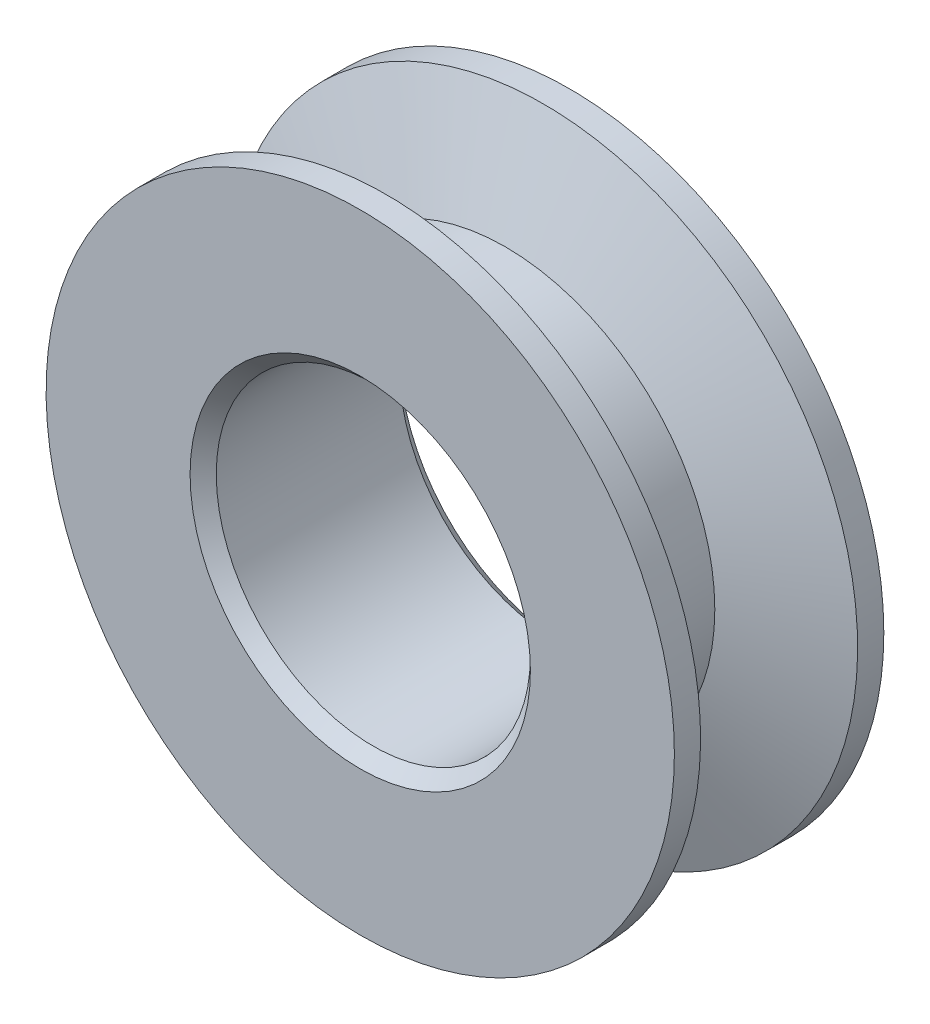
from build123d import *

# Parameters (mm, degrees)
SKETCH1_R      = 19.05
SKETCH1_R_2    = 9.525
EXTRUDE1_DEPTH = 6.35
CHAMFER1_SIZE  = 0.79375


with BuildPart() as part:
    # Sketch1 → Extrude1 (new, symmetric)
    with BuildSketch(Plane.XY):
        Circle(SKETCH1_R)
        Circle(SKETCH1_R_2, mode=Mode.SUBTRACT)
    extrude(amount=EXTRUDE1_DEPTH, both=True)

    # Chamfer1
    chamfer1_edges = [part.edges().sort_by_distance(p)[0] for p in [
        (-9.525, 0, -6.35),
        (-9.525, 0, 6.35),
    ]]
    chamfer(chamfer1_edges, length=CHAMFER1_SIZE)

    # Sketch2 → Cut-Revolve1 (revolve, cut)
    with BuildSketch(Plane(origin=(0, 0, 0), x_dir=(0, 0, -1), z_dir=(1, 0, 0))):
        Polygon((-4.7625, 19.05), (4.7625, 19.05), (2.451289012, 12.7), (-2.451289012, 12.7), align=None)
    revolve(axis=Axis((0, 0, 6.35), (0, 0, -1)), mode=Mode.SUBTRACT)


solid = part.part
